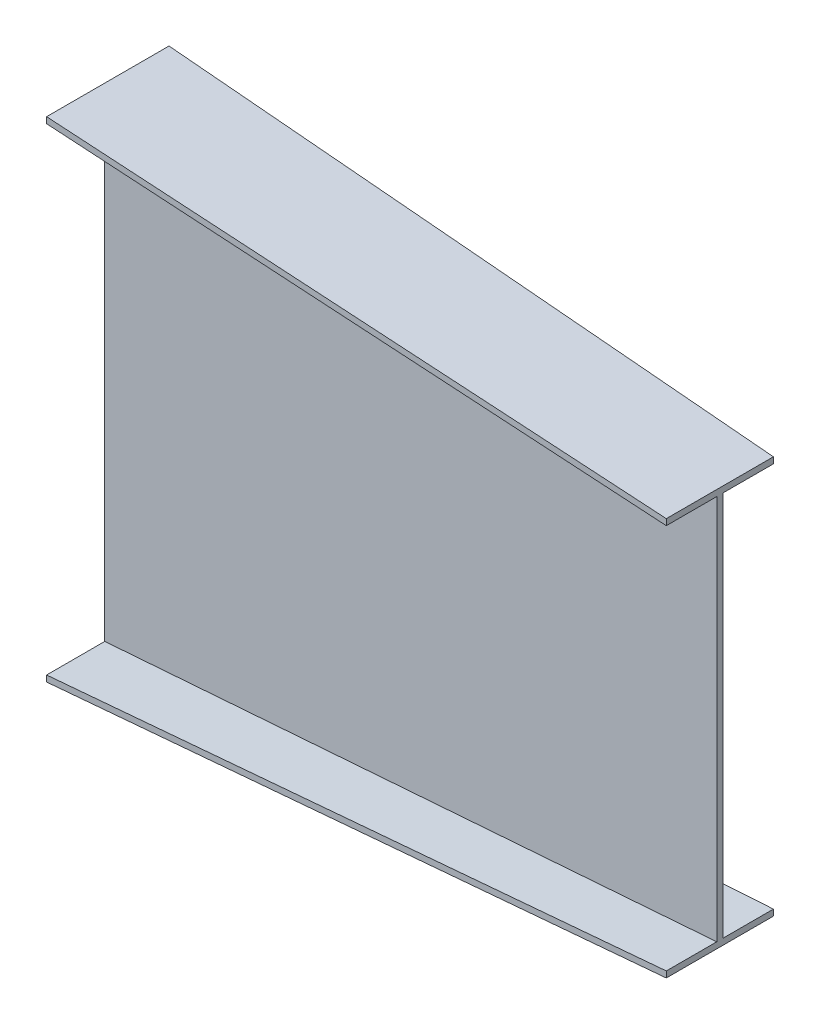
from build123d import *


with BuildPart() as part:
    # Sketch1 → Loft l1 section 0
    with BuildSketch(Plane(origin=(0, 0, 0), x_dir=(0, 0, -1), z_dir=(1, 0, 0))):
        with BuildLine():
            Line((-105, 400), (95, 400))
            Line((95, 400), (95, 390))
            Line((95, 390), (0, 390))
            Line((0, 390), (0, -390))
            Line((0, -390), (95, -390))
            Line((95, -390), (95, -400))
            Line((95, -400), (-105, -400))
            Line((-105, -400), (-105, -390))
            Line((-105, -390), (-10, -390))
            Line((-10, -390), (-10, 390))
            Line((-10, 390), (-105, 390))
            Line((-105, 390), (-105, 400))
        make_face()
    # Sketch4 → Loft l1 section 1
    with BuildSketch(Plane(origin=(1000, 0, -1000), x_dir=(0, 0, 1), z_dir=(-1, 0, 0))):
        with BuildLine():
            Line((917.5, 325), (1092.5, 325))
            Line((1092.5, 325), (1092.5, 315))
            Line((1092.5, 315), (1010, 315))
            Line((1010, 315), (1010, -315))
            Line((1010, -315), (1092.5, -315))
            Line((1092.5, -315), (1092.5, -325))
            Line((1092.5, -325), (917.5, -325))
            Line((917.5, -325), (917.5, -315))
            Line((917.5, -315), (1000, -315))
            Line((1000, -315), (1000, 315))
            Line((1000, 315), (917.5, 315))
            Line((917.5, 315), (917.5, 325))
        make_face()
    loft()


solid = part.part
